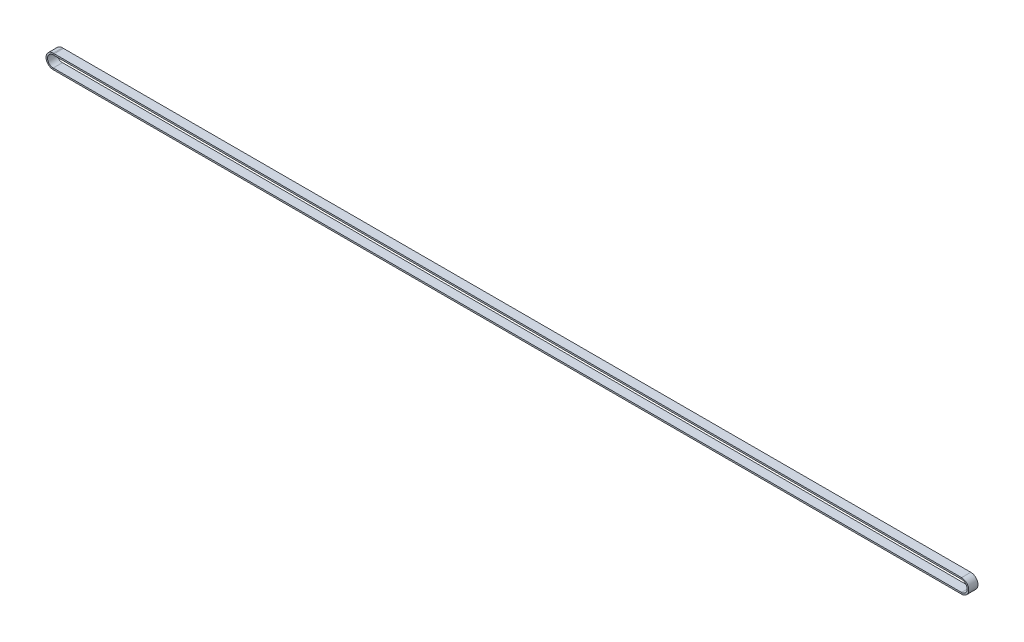
from build123d import *

# Parameters (mm, degrees)
SKETCH3_W = 9
SKETCH3_H = 1.5


with BuildPart() as part:
    # Sweep1: sweep along a path in Sketch2
    with BuildLine(Plane.XY) as sweep1_path:
        Line((-1, -33.342009587), (883.520796874, -33.342009587))
        ThreePointArc((883.520796874, -33.342009587), (890.520796874, -40.342009587), (883.520796874, -47.342009587))
        Line((883.520796874, -47.342009587), (-1, -47.342009587))
        ThreePointArc((-1, -47.342009587), (-8, -40.342009587), (-1, -33.342009587))
    # Sketch3 → Sweep1 (sweep)
    with BuildSketch(Plane(origin=(0, 0, 0), x_dir=(0, 0, -1), z_dir=(1, 0, 0))):
        with Locations((-4.5, -34.092009587)):
            Rectangle(SKETCH3_W, SKETCH3_H)
    sweep(path=sweep1_path.line)


solid = part.part
